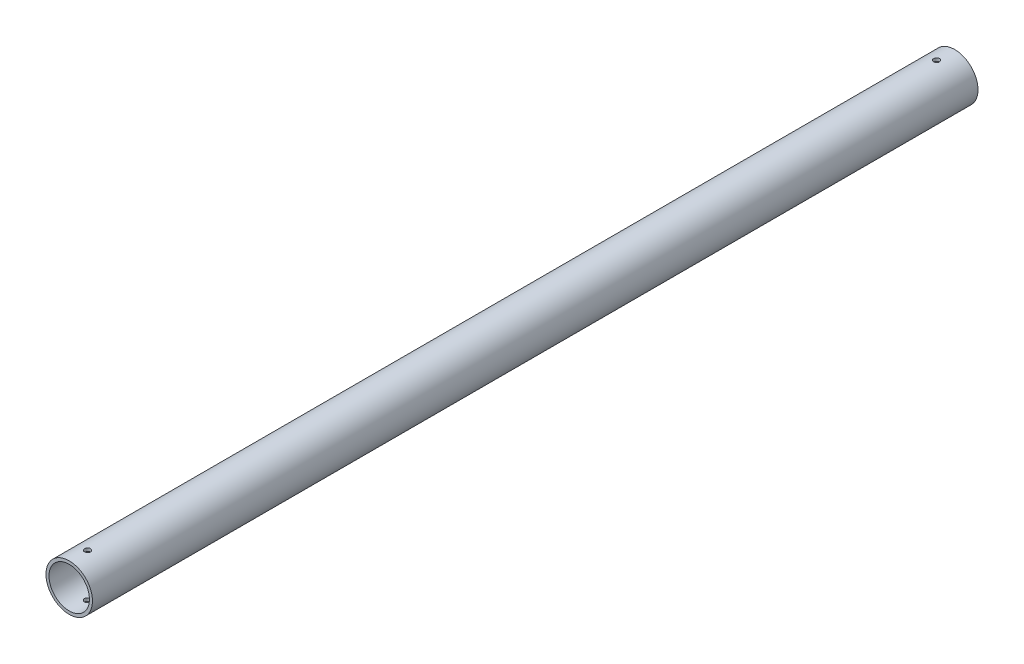
from build123d import *

# Parameters (mm, degrees)
SKETCH1_R           = 12.7
SKETCH1_R_2         = 11.049
BOSS_EXTRUDE1_DEPTH = 242
SKETCH2_R           = 1.6
CUT_EXTRUDE1_DEPTH  = 243.665572342


with BuildPart() as part:
    # Sketch1 → Boss-Extrude1 (new, symmetric)
    with BuildSketch(Plane.XY):
        Circle(SKETCH1_R)
        Circle(SKETCH1_R_2, mode=Mode.SUBTRACT)
    extrude(amount=BOSS_EXTRUDE1_DEPTH, both=True)

    # Sketch2 → Cut-Extrude1 (cut, symmetric)
    with BuildSketch(Plane(origin=(0, 0, 0), x_dir=(1, 0, 0), z_dir=(0, 1, 0))):
        with Locations((0, -232)):
            Circle(SKETCH2_R)
    cut_extrude1 = extrude(amount=CUT_EXTRUDE1_DEPTH, both=True, mode=Mode.SUBTRACT)

    # Mirror1: Cut-Extrude1 across plane
    add(cut_extrude1.mirror(Plane.XY), mode=Mode.SUBTRACT)


solid = part.part
